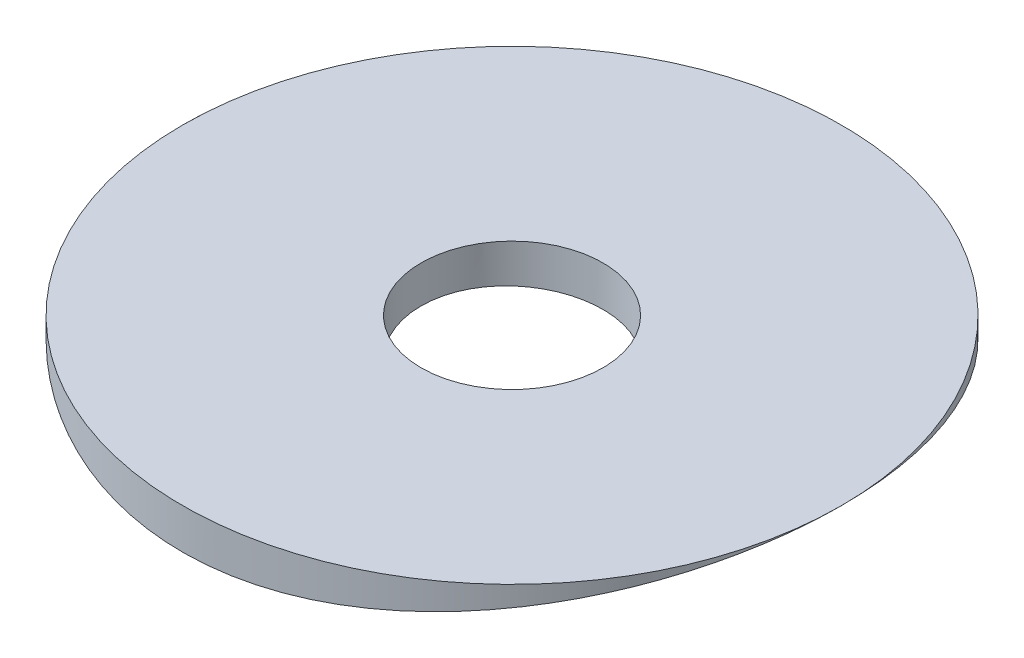
from build123d import *

# Parameters (mm, degrees)
BOSS_EXTRUDE1_DEPTH = 23.0124
SKETCH2_W           = 44.611940252
SKETCH2_H           = 41.110401543
SKETCH2_R           = 11.5062
CUT_EXTRUDE3_DEPTH  = 2.54
SKETCH3_R           = 3.175
CUT_EXTRUDE4_DEPTH  = 26.767192872


with BuildPart() as part:
    # Sketch1 → Boss-Extrude1 (new body)
    with BuildSketch(Plane.XY):
        with BuildLine():
            Line((-11.5062, -46.279589387), (11.5062, -46.279589387))
            ThreePointArc((11.5062, -46.279589387), (0, -47.6885), (-11.5062, -46.279589387))
        make_face()
    extrude(amount=BOSS_EXTRUDE1_DEPTH)

    # Sketch2 → Cut-Extrude3 (cut)
    with BuildSketch(Plane(origin=(0, -46.279589387, 0), x_dir=(1, 0, 0), z_dir=(0, 1, 0))):
        with Locations((2.111795661, -11.044209065)):
            Rectangle(SKETCH2_W, SKETCH2_H)
        with Locations((0, -11.5062)):
            Circle(SKETCH2_R, mode=Mode.SUBTRACT)
    extrude(amount=-CUT_EXTRUDE3_DEPTH, mode=Mode.SUBTRACT)

    # Sketch3 → Cut-Extrude4 (cut, through all)
    with BuildSketch(Plane(origin=(0, -46.279589387, 0), x_dir=(1, 0, 0), z_dir=(0, 1, 0))):
        with Locations((0, -11.5062)):
            Circle(SKETCH3_R)
    extrude(amount=-CUT_EXTRUDE4_DEPTH, mode=Mode.SUBTRACT)


solid = part.part
